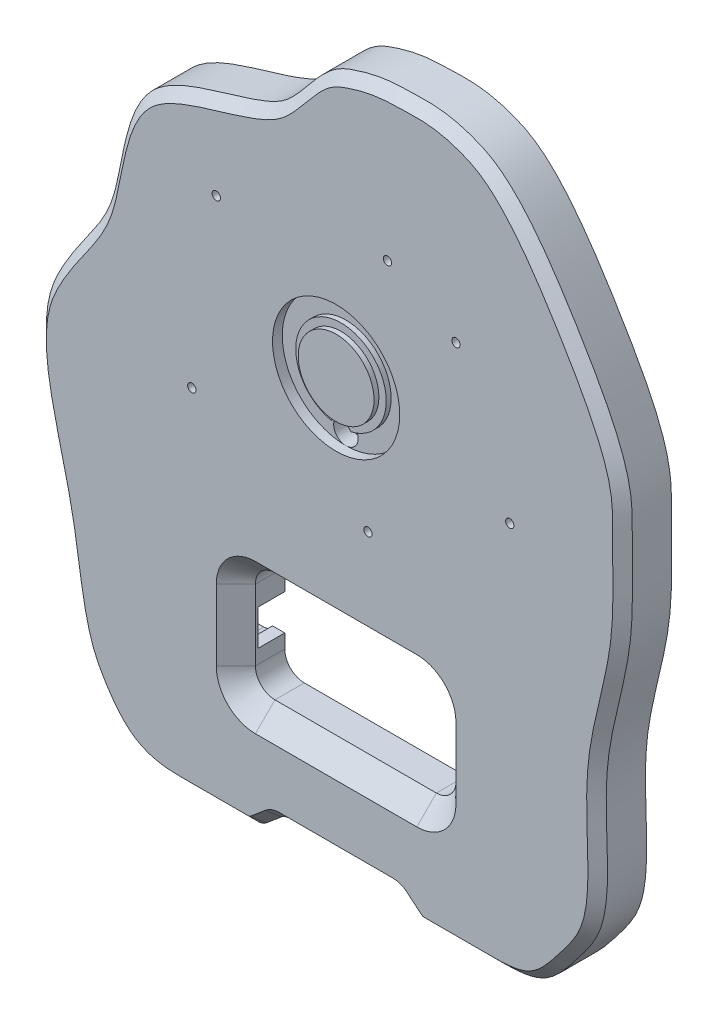
from build123d import *

# Parameters (mm, degrees)
SKIZZE1_W                                            = 260
SKIZZE1_H                                            = 300
AUFSATZ_LINEAR_AUSTRAGEN1_DEPTH                      = 20
SKIZZE2_W                                            = 82
SKIZZE2_H                                            = 45
SCHNITT_LINEAR_AUSTRAGEN1_DEPTH                      = 200.499373433
VERRUNDUNG1_R                                        = 8
FASE1_SIZE                                           = 8
STIRNSENKUNG_F_R_M3_FLACHKOPFSCHRAUBE_MI_D           = 3.4
STIRNSENKUNG_F_R_M3_FLACHKOPFSCHRAUBE_MI_CBORE_D     = 7
STIRNSENKUNG_F_R_M3_FLACHKOPFSCHRAUBE_MI_CBORE_DEPTH = 4.4
SKIZZE9_W                                            = 36
SKIZZE9_H                                            = 22
SCHNITT_LINEAR_AUSTRAGEN3_DEPTH                      = 11
SKIZZE10_W                                           = 382.36664372
SKIZZE10_H                                           = 354.574329602
KONTOUR_DEPTH                                        = 200.499373433
VERRUNDUNG3_R                                        = 5
FASE2_SIZE                                           = 4
SCHNITT_LINEAR_AUSTRAGEN5_DEPTH                      = 10
SKIZZE7_R                                            = 26
SKIZZE7_R_2                                          = 15.5
SCHNITT_LINEAR_AUSTRAGEN6_DEPTH                      = 2
SKIZZE12_W                                           = 5
SKIZZE12_H                                           = 5.2
SKIZZE12_H_2                                         = 2.2
SKIZZE12_H_3                                         = 5.7
AUFSATZ_LINEAR_AUSTRAGEN2_DEPTH                      = 11
CHANNEL_DEPTH                                        = 10
VERRUNDUNG4_DEPTH                                    = 12
F_3_0_3_DURCHMESSER_BOHRUNG1_D                       = 3
F_3_0_3_DURCHMESSER_BOHRUNG1_DEPTH                   = 5
F_3_0_3_DURCHMESSER_BOHRUNG1_TIP                     = 0.901290929
F_3_0_3_DURCHMESSER_BOHRUNG2_D                       = 3
F_3_0_3_DURCHMESSER_BOHRUNG2_DEPTH                   = 5
F_3_0_3_DURCHMESSER_BOHRUNG2_TIP                     = 0.901290929
SKIZZE19_R                                           = 5
SCHNITT_LINEAR_AUSTRAGEN8_DEPTH                      = 192.616928232
F_3_0_3_DURCHMESSER_BOHRUNG3_D                       = 3
F_3_0_3_DURCHMESSER_BOHRUNG3_DEPTH                   = 5
F_3_0_3_DURCHMESSER_BOHRUNG3_TIP                     = 0.901290929
SKIZZE22_R                                           = 26
SKIZZE22_R_2                                         = 18.5
SCHNITT_LINEAR_AUSTRAGEN9_DEPTH                      = 2


with BuildPart() as part:
    # Skizze1 → Aufsatz-Linear austragen1 (new body)
    with BuildSketch(Plane.XY):
        Rectangle(SKIZZE1_W, SKIZZE1_H)
    extrude(amount=AUFSATZ_LINEAR_AUSTRAGEN1_DEPTH)

    # Skizze2 → Schnitt-Linear austragen1 (cut, through all)
    with BuildSketch(Plane.XY.offset(20)):
        with Locations((0, -82)):
            Rectangle(SKIZZE2_W, SKIZZE2_H)
    extrude(amount=-SCHNITT_LINEAR_AUSTRAGEN1_DEPTH, mode=Mode.SUBTRACT)

    # Verrundung1
    verrundung1_edges = [part.edges().sort_by_distance(p)[0] for p in [
        (-41, -104.5, 10),
        (-41, -59.5, 10),
        (41, -59.5, 10),
        (41, -104.5, 10),
    ]]
    fillet(verrundung1_edges, radius=VERRUNDUNG1_R)

    # Fase1
    fase1_edges = [part.edges().sort_by_distance(p)[0] for p in [
        (0, -104.5, 20),
        (-41, -82, 20),
        (41, -82, 20),
        (0, -59.5, 20),
        (-38.656854249, -102.156854249, 20),
        (38.656854249, -102.156854249, 20),
        (38.656854249, -61.843145751, 20),
        (-38.656854249, -61.843145751, 20),
    ]]
    chamfer(fase1_edges, length=FASE1_SIZE)

    # Stirnsenkung für M3 Flachkopfschraube mit Schlitz1 (through all)
    with Locations(Plane(origin=(0, 0, 0), x_dir=(-1, 0, 0), z_dir=(0, 0, -1))):
        with Locations((-49, 67), (-21, 82), (49, 70), (59, -3), (-13, -18), (-71, 14)):
            CounterBoreHole(STIRNSENKUNG_F_R_M3_FLACHKOPFSCHRAUBE_MI_D / 2, STIRNSENKUNG_F_R_M3_FLACHKOPFSCHRAUBE_MI_CBORE_D / 2, STIRNSENKUNG_F_R_M3_FLACHKOPFSCHRAUBE_MI_CBORE_DEPTH)

    # Skizze9 → Schnitt-Linear austragen3 (cut)
    with BuildSketch(Plane(origin=(0, 0, 0), x_dir=(-1, 0, 0), z_dir=(0, 0, -1))):
        with Locations((-59, -82)):
            Rectangle(SKIZZE9_W, SKIZZE9_H)
        with Locations((59, -82)):
            Rectangle(SKIZZE9_W, SKIZZE9_H)
    extrude(amount=-SCHNITT_LINEAR_AUSTRAGEN3_DEPTH, mode=Mode.SUBTRACT)

    # Skizze10 → Kontour (cut, through all)
    with BuildSketch(Plane.XY.offset(20)):
        Rectangle(SKIZZE10_W, SKIZZE10_H)
        with BuildLine():
            Line((-25, -139.5), (25, -139.5))
            Line((25, -139.5), (33.938151944, -147))
            Line((33.938151944, -147), (63.938151944, -147))
            add(Edge.make_bspline(
                [(63.938151944, -147), (81.006072961, -147), (85.661758767, -142.560830251), (111.87524094, -107.349085357), (100.690478562, -61.839050171), (118.642058827, -11.337226255), (116.847153551, 19.268567399), (117.300382472, 48.320679455), (110.351730555, 70.93320541), (69.816358172, 131.483370927), (42.987055075, 143.330402159), (26.189880568, 142.198706511), (12.905703827, 142.357553701), (-10.108530169, 133.769465571), (-19.525543935, 115.629039104), (-44.989722369, 103.830469958), (-90.28034156, 97.824210458), (-91.196663098, 38.951705116), (-107.624167759, 25.00644222), (-129.422650785, -15.606309569), (-110.161594786, -62.395573163), (-107.159765201, -111.003947679), (-89.562561807, -141.083722695), (-79.594703106, -147), (-63.938151944, -147)],
                knots=[0, 0, 0, 0, 0.180255727, 0.217196083, 0.369403561, 0.474798047, 0.558759628, 0.575055064, 0.63775241, 0.664616212, 0.670473933, 0.696329621, 0.721180734, 0.726402494, 0.7460867, 0.752576385, 0.788838817, 0.83096373, 0.869174463, 0.878591026, 0.925129355, 0.953403391, 0.960890456, 1, 1, 1, 1], degree=3))
            Line((-63.938151944, -147), (-33.938151944, -147))
            Line((-33.938151944, -147), (-25, -139.5))
        make_face(mode=Mode.SUBTRACT)
    extrude(amount=-KONTOUR_DEPTH, mode=Mode.SUBTRACT)

    # Verrundung3
    verrundung3_edges = [part.edges().sort_by_distance(p)[0] for p in [
        (33.938151944, -147, 10),
        (25, -139.5, 10),
        (-25, -139.5, 10),
        (-33.938151944, -147, 10),
    ]]
    fillet(verrundung3_edges, radius=VERRUNDUNG3_R)

    # Fase2
    fase2_edges = [part.edges().sort_by_distance(p)[0] for p in [
        (-49.84807753, -147, 20),
        (0, -139.5, 20),
        (-29.469075972, -143.25, 20),
        (0, -139.5, 20),
        (29.469075972, -143.25, 20),
        (49.84807753, -147, 20),
        (34.047902399, -146.698463104, 20),
        (-34.047902399, -146.698463104, 20),
        (-24.890249545, -139.801536896, 20),
        (24.890249545, -139.801536896, 20),
    ]]
    chamfer(fase2_edges, length=FASE2_SIZE)

    # Skizze11 → Schnitt-Linear austragen5 (cut)
    with BuildSketch(Plane(origin=(0, 0, 0), x_dir=(-1, 0, 0), z_dir=(0, 0, -1))):
        Polygon((-12.3, -139.5), (-12.3, -130.5), (-35, -130.5), (-35, -110.5), (35, -110.5), (35, -130.5), (12.3, -130.5), (12.3, -139.5), align=None)
    extrude(amount=-SCHNITT_LINEAR_AUSTRAGEN5_DEPTH, mode=Mode.SUBTRACT)

    # Skizze7 → Schnitt-Linear austragen6 (cut)
    with BuildSketch(Plane.XY.offset(20)):
        with Locations((0, 30)):
            Circle(SKIZZE7_R)
        with Locations((0, 30)):
            Circle(SKIZZE7_R_2, mode=Mode.SUBTRACT)
    extrude(amount=-SCHNITT_LINEAR_AUSTRAGEN6_DEPTH, mode=Mode.SUBTRACT)

    # Skizze12 → Aufsatz-Linear austragen2 (add)
    with BuildSketch(Plane(origin=(0, 0, 11), x_dir=(-1, 0, 0), z_dir=(0, 0, -1))):
        with Locations((43.5, -73.6)):
            Rectangle(SKIZZE12_W, SKIZZE12_H)
        with Locations((43.5, -91.9)):
            Rectangle(SKIZZE12_W, SKIZZE12_H_2)
        with Locations((-43.5, -73.85)):
            Rectangle(SKIZZE12_W, SKIZZE12_H_3)
        with Locations((-43.5, -90.15)):
            Rectangle(SKIZZE12_W, SKIZZE12_H_3)
    extrude(amount=AUFSATZ_LINEAR_AUSTRAGEN2_DEPTH)

    # Skizze13 → Channel (cut)
    with BuildSketch(Plane(origin=(0, 0, 0), x_dir=(-1, 0, 0), z_dir=(0, 0, -1))):
        Polygon((-7, 24.5), (7, 24.5), (7, -35.5), (17, -35.5), (17, -9.5), (87, -9.5), (87, -49.5), (-63, -49.5), (-63, -113.5), (0, -113.5), (0, -127.5), (-77, -127.5), (-77, -35.5), (-7, -35.5), align=None)
    extrude(amount=-CHANNEL_DEPTH, mode=Mode.SUBTRACT)

    # Verrundung4: read off the stored shape, not the designer's step
    # Verrundung4 outline → Verrundung4 (add)
    with BuildSketch(Plane.XY):
        with BuildLine():
            ThreePointArc((46, -75), (47.171572875, -72.171572875), (50, -71))
            Line((50, -71), (46, -71))
            Line((46, -71), (46, -75))
        make_face()
        with BuildLine():
            ThreePointArc((-83, -49.5), (-85.828427125, -48.328427125), (-87, -45.5))
            Line((-87, -45.5), (-87, -49.5))
            Line((-87, -49.5), (-83, -49.5))
        make_face()
        with BuildLine():
            ThreePointArc((-87, -13.5), (-85.828427125, -10.671572875), (-83, -9.5))
            Line((-83, -9.5), (-87, -9.5))
            Line((-87, -9.5), (-87, -13.5))
        make_face()
        with BuildLine():
            ThreePointArc((-21, -9.5), (-18.171572875, -10.671572875), (-17, -13.5))
            Line((-17, -13.5), (-17, -9.5))
            Line((-17, -9.5), (-21, -9.5))
        make_face()
        with BuildLine():
            ThreePointArc((-7, 20.5), (-5.828427125, 23.328427125), (-3, 24.5))
            Line((-3, 24.5), (-7, 24.5))
            Line((-7, 24.5), (-7, 20.5))
        make_face()
        with BuildLine():
            ThreePointArc((3, 24.5), (5.828427125, 23.328427125), (7, 20.5))
            Line((7, 20.5), (7, 24.5))
            Line((7, 24.5), (3, 24.5))
        make_face()
        with BuildLine():
            ThreePointArc((73, -35.5), (75.828427125, -36.671572875), (77, -39.5))
            Line((77, -39.5), (77, -35.5))
            Line((77, -35.5), (73, -35.5))
        make_face()
        with BuildLine():
            Line((35, -130.5), (35, -127.5))
            ThreePointArc((35, -127.5), (33.576506397, -129.66227766), (31.127016654, -130.5))
            Line((31.127016654, -130.5), (35, -130.5))
        make_face()
        with BuildLine():
            Line((77, -127.5), (77, -123.5))
            ThreePointArc((77, -123.5), (75.828427125, -126.328427125), (73, -127.5))
            Line((73, -127.5), (77, -127.5))
        make_face()
        with BuildLine():
            ThreePointArc((50, -93), (47.171572875, -91.828427125), (46, -89))
            Line((46, -89), (46, -93))
            Line((46, -93), (50, -93))
        make_face()
        with BuildLine():
            ThreePointArc((-31, -130.5), (-33.828427125, -129.328427125), (-35, -126.5))
            Line((-35, -126.5), (-35, -130.5))
            Line((-35, -130.5), (-31, -130.5))
        make_face()
        with BuildLine():
            ThreePointArc((-35, -114.5), (-33.828427125, -111.671572875), (-31, -110.5))
            Line((-31, -110.5), (-35, -110.5))
            Line((-35, -110.5), (-35, -114.5))
        make_face()
        with BuildLine():
            ThreePointArc((31.127016654, -110.5), (33.576506397, -111.33772234), (35, -113.5))
            Line((35, -113.5), (35, -110.5))
            Line((35, -110.5), (31.127016654, -110.5))
        make_face()
        with BuildLine():
            ThreePointArc((-46, -90.8), (-47.474496524, -92.405877273), (-49.57211422, -93))
            Line((-49.57211422, -93), (-46, -93))
            Line((-46, -93), (-46, -90.8))
        make_face()
        with BuildLine():
            Line((-46, -71), (-50, -71))
            ThreePointArc((-50, -71), (-47.171572875, -72.171572875), (-46, -75))
            Line((-46, -75), (-46, -71))
        make_face()
        with BuildLine():
            Line((-77, -71), (-77, -75))
            ThreePointArc((-77, -75), (-75.828427125, -72.171572875), (-73, -71))
            Line((-73, -71), (-77, -71))
        make_face()
        with BuildLine():
            ThreePointArc((-73, -93), (-75.828427125, -91.828427125), (-77, -89))
            Line((-77, -89), (-77, -93))
            Line((-77, -93), (-73, -93))
        make_face()
    extrude(amount=VERRUNDUNG4_DEPTH)

    # Ø3.0 (3) Durchmesser Bohrung1
    with Locations(Plane(origin=(0, 0, 11), x_dir=(-1, 0, 0), z_dir=(0, 0, -1))):
        with Locations((65.987360935, -83.487325375), (53.987360935, -83.487325375), (-50.987363475, -83.487325375), (-64.987363475, -83.487325375)):
            Hole(F_3_0_3_DURCHMESSER_BOHRUNG1_D / 2, depth=F_3_0_3_DURCHMESSER_BOHRUNG1_DEPTH)
            with Locations((0, 0, -(F_3_0_3_DURCHMESSER_BOHRUNG1_DEPTH + F_3_0_3_DURCHMESSER_BOHRUNG1_TIP / 2))):  # 118° drill point
                Cone(0, F_3_0_3_DURCHMESSER_BOHRUNG1_D / 2, F_3_0_3_DURCHMESSER_BOHRUNG1_TIP, mode=Mode.SUBTRACT)

    # Ø3.0 (3) Durchmesser Bohrung2
    with Locations(Plane(origin=(0, 0, 10), x_dir=(-1, 0, 0), z_dir=(0, 0, -1))):
        with Locations((-18, -121.5), (18, -121.5)):
            Hole(F_3_0_3_DURCHMESSER_BOHRUNG2_D / 2, depth=F_3_0_3_DURCHMESSER_BOHRUNG2_DEPTH)
            with Locations((0, 0, -(F_3_0_3_DURCHMESSER_BOHRUNG2_DEPTH + F_3_0_3_DURCHMESSER_BOHRUNG2_TIP / 2))):  # 118° drill point
                Cone(0, F_3_0_3_DURCHMESSER_BOHRUNG2_D / 2, F_3_0_3_DURCHMESSER_BOHRUNG2_TIP, mode=Mode.SUBTRACT)

    # Skizze19 → Schnitt-Linear austragen8 (cut, through all)
    with BuildSketch(Plane(origin=(0, 0, 10), x_dir=(-1, 0, 0), z_dir=(0, 0, -1))):
        with Locations((0, 9)):
            Circle(SKIZZE19_R)
    extrude(amount=-SCHNITT_LINEAR_AUSTRAGEN8_DEPTH, mode=Mode.SUBTRACT)

    # Ø3.0 (3) Durchmesser Bohrung3
    with Locations(Plane(origin=(0, 0, 0), x_dir=(-1, 0, 0), z_dir=(0, 0, -1))):
        with Locations((-54, -104), (-54, -60), (-54, 5), (-54, 45), (54, 45), (54, 5), (54, -60), (54, -104)):
            Hole(F_3_0_3_DURCHMESSER_BOHRUNG3_D / 2, depth=F_3_0_3_DURCHMESSER_BOHRUNG3_DEPTH)
            with Locations((0, 0, -(F_3_0_3_DURCHMESSER_BOHRUNG3_DEPTH + F_3_0_3_DURCHMESSER_BOHRUNG3_TIP / 2))):  # 118° drill point
                Cone(0, F_3_0_3_DURCHMESSER_BOHRUNG3_D / 2, F_3_0_3_DURCHMESSER_BOHRUNG3_TIP, mode=Mode.SUBTRACT)

    # Skizze22 → Schnitt-Linear austragen9 (cut)
    with BuildSketch(Plane.XY.offset(18)):
        with Locations((0, 30)):
            Circle(SKIZZE22_R)
        with Locations((0, 30)):
            Circle(SKIZZE22_R_2, mode=Mode.SUBTRACT)
    extrude(amount=-SCHNITT_LINEAR_AUSTRAGEN9_DEPTH, mode=Mode.SUBTRACT)


solid = part.part
